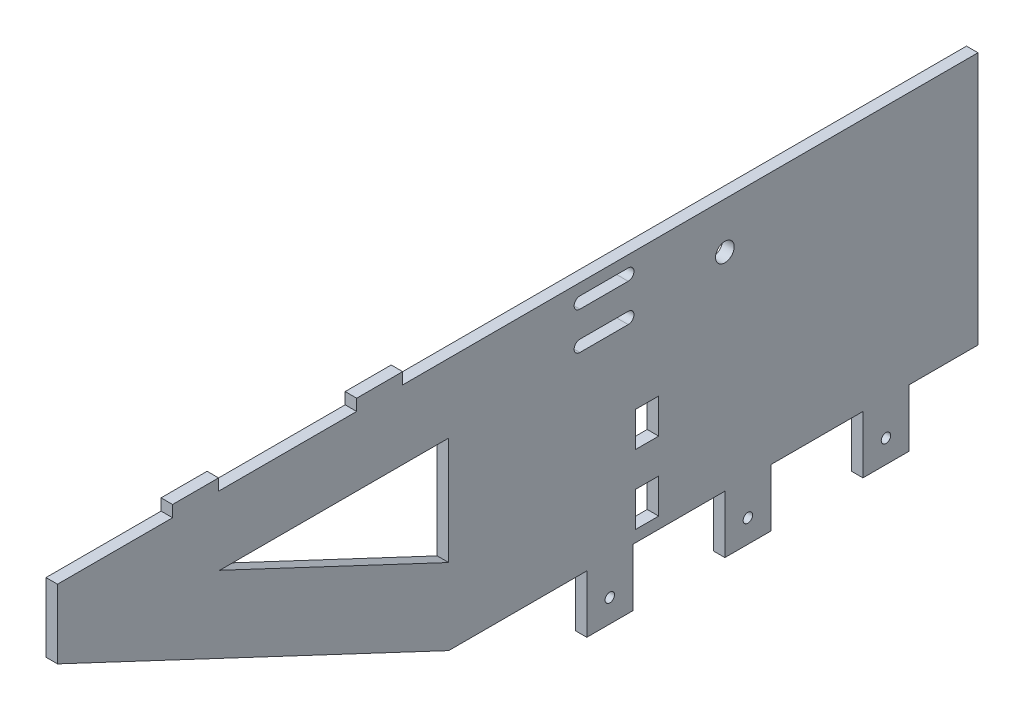
from build123d import *

# Parameters (mm, degrees)
SKETCH_1_W          = 200
SKETCH_1_H          = 110
SKETCH_1_R          = 4.05
EXTRUDE_1_DEPTH     = 5
SKETCH_2_W          = 20
SKETCH_2_H          = 25
SKETCH_2_R          = 2.05
EXTRUDE_2_DEPTH     = 5
EXTRUDE_3_DEPTH     = 5
SKETCH_4_W          = 10.1
SKETCH_4_H          = 15.1
CUT_EXTRUDE_1_DEPTH = 311.523751104
SKETCH_5_W          = 5
SKETCH_5_H          = 20
EXTRUDE_4_DEPTH     = 5
CUT_EXTRUDE_2_DEPTH = 311.523751104


with BuildPart() as part:
    # 草圖1 → 填料-伸長1 (new body)
    with BuildSketch(Plane(origin=(0, 0, 0), x_dir=(0, 0, -1), z_dir=(1, 0, 0))):
        Rectangle(SKETCH_1_W, SKETCH_1_H)
        with Locations((-10, 35)):
            Circle(SKETCH_1_R, mode=Mode.SUBTRACT)
    extrude(amount=EXTRUDE_1_DEPTH)

    # 草圖2 → 填料-伸長2 (add)
    # profile 1 of 3: a face of its own
    with BuildSketch(Plane(origin=(5, 0, 0), x_dir=(0, 0, -1), z_dir=(1, 0, 0))):
        with Locations((-60, -67.5)):
            Rectangle(SKETCH_2_W, SKETCH_2_H)
        with Locations((-60, -70)):
            Circle(SKETCH_2_R, mode=Mode.SUBTRACT)
    # profile 2 of 3: a face of its own
    with BuildSketch(Plane(origin=(5, 0, 0), x_dir=(0, 0, -1), z_dir=(1, 0, 0))):
        with Locations((0, -67.5)):
            Rectangle(SKETCH_2_W, SKETCH_2_H)
        with Locations((0, -70)):
            Circle(SKETCH_2_R, mode=Mode.SUBTRACT)
    # profile 3 of 3: a face of its own
    with BuildSketch(Plane(origin=(5, 0, 0), x_dir=(0, 0, -1), z_dir=(1, 0, 0))):
        with Locations((60, -67.5)):
            Rectangle(SKETCH_2_W, SKETCH_2_H)
        with Locations((60, -70)):
            Circle(SKETCH_2_R, mode=Mode.SUBTRACT)
    extrude(amount=-EXTRUDE_2_DEPTH)

    # 草圖3 → 填料-伸長3 (add)
    with BuildSketch(Plane(origin=(5, 0, 0), x_dir=(0, 0, -1), z_dir=(1, 0, 0))):
        Polygon((-100, 55), (-300, 55), (-300, 25), (-130, -55), (-100, -55), align=None)
        Polygon((-130, 25), (-130, -21.844186656), (-229.543896645, 25), align=None, mode=Mode.SUBTRACT)
    extrude(amount=-EXTRUDE_3_DEPTH)

    # 草圖4 → 除料-伸長1 (cut, through all)
    with BuildSketch(Plane(origin=(5, 0, 0), x_dir=(0, 0, -1), z_dir=(1, 0, 0))):
        with Locations((-43.8, -12.35)):
            Rectangle(SKETCH_4_W, SKETCH_4_H)
        with Locations((-43.8, -42.45)):
            Rectangle(SKETCH_4_W, SKETCH_4_H)
    extrude(amount=-CUT_EXTRUDE_1_DEPTH, mode=Mode.SUBTRACT)

    # 草圖5 → 填料-伸長4 (add)
    with BuildSketch(Plane(origin=(0, 55, 0), x_dir=(1, 0, 0), z_dir=(0, 1, 0))):
        with Locations((2.5, -160)):
            Rectangle(SKETCH_5_W, SKETCH_5_H)
        with Locations((2.5, -240)):
            Rectangle(SKETCH_5_W, SKETCH_5_H)
    extrude(amount=EXTRUDE_4_DEPTH)

    # 草圖6 → 除料-伸長2 (cut, through all)
    with BuildSketch(Plane(origin=(5, 0, 0), x_dir=(0, 0, -1), z_dir=(1, 0, 0))):
        with BuildLine():
            Line((-73, 50), (-52, 50))
            ThreePointArc((-52, 50), (-49.5, 47.5), (-52, 45))
            Line((-52, 45), (-73, 45))
            ThreePointArc((-73, 45), (-75.5, 47.5), (-73, 50))
        make_face()
        with BuildLine():
            Line((-73, 33.7), (-52, 33.7))
            ThreePointArc((-52, 33.7), (-49.5, 31.2), (-52, 28.7))
            Line((-52, 28.7), (-73, 28.7))
            ThreePointArc((-73, 28.7), (-75.5, 31.2), (-73, 33.7))
        make_face()
    extrude(amount=-CUT_EXTRUDE_2_DEPTH, mode=Mode.SUBTRACT)


solid = part.part
